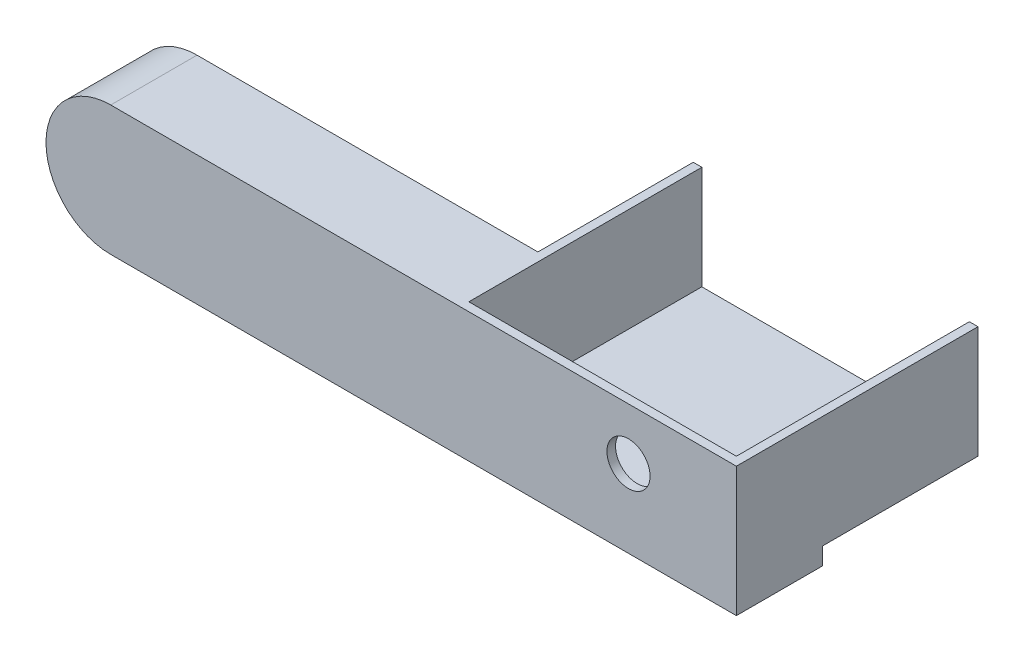
from build123d import *

# Parameters (mm, degrees)
SKETCH1_W                = 80
SKETCH1_H                = 15
BOSS_EXTRUDE1_DEPTH      = 10
FILLET1_R                = 7.5
BOSS_EXTRUDE2_DEPTH      = 2
BOSS_EXTRUDE2_DEPTH_BACK = 13
SKETCH2_R                = 3.5
SKETCH2_R_2              = 2.5
SKETCH4_W                = 12.275600057
SKETCH4_H                = 15
CUT_EXTRUDE1_DEPTH       = 39
SKETCH6_W                = 10
SKETCH6_H                = 14.887271561
CUT_EXTRUDE2_DEPTH       = 39
SKETCH8_W                = 33
SKETCH8_H                = 28
BOSS_EXTRUDE3_DEPTH      = 15
CUT_EXTRUDE3_DEPTH       = 12
SKETCH10_W               = 33
SKETCH10_H               = 18
CUT_EXTRUDE4_DEPTH       = 2
SKETCH11_W               = 11.438718319
SKETCH11_H               = 15
CUT_EXTRUDE5_DEPTH       = 84.360662185
SKETCH12_R               = 2.5
CUT_EXTRUDE6_DEPTH       = 86.755466298


with BuildPart() as part:
    # Sketch1 → Boss-Extrude1 (new body)
    with BuildSketch(Plane.XY):
        with Locations((40, 7.5)):
            Rectangle(SKETCH1_W, SKETCH1_H)
    extrude(amount=BOSS_EXTRUDE1_DEPTH)

    # Fillet1
    fillet1_edges = [part.edges().sort_by_distance(p)[0] for p in [
        (0, 0, 5),
        (0, 15, 5),
    ]]
    fillet(fillet1_edges, radius=FILLET1_R - 0.0001)  # a hair under: the kernel refuses the full size

    # Sketch2 → Boss-Extrude2 (add, two sides: drawn at the far end of the back side and taken through both)
    # profile 1 of 2: a face of its own
    with BuildSketch(Plane.XY.offset(10).offset(-BOSS_EXTRUDE2_DEPTH_BACK)):
        with Locations((7.5, 7.5)):
            Circle(SKETCH2_R)
        with Locations((7.5, 7.5)):
            Circle(SKETCH2_R_2, mode=Mode.SUBTRACT)
    # profile 2 of 2: a face of its own
    with BuildSketch(Plane.XY.offset(10).offset(-BOSS_EXTRUDE2_DEPTH_BACK)):
        with Locations((72.5, 7.5)):
            Circle(SKETCH2_R)
        with Locations((72.5, 7.5)):
            Circle(SKETCH2_R_2, mode=Mode.SUBTRACT)
    extrude(amount=BOSS_EXTRUDE2_DEPTH + BOSS_EXTRUDE2_DEPTH_BACK)

    # Sketch4 → Cut-Extrude1 (cut)
    with BuildSketch(Plane(origin=(80, 0, 0), x_dir=(0, 0, -1), z_dir=(1, 0, 0))):
        with Locations((6.137800029, 7.5)):
            Rectangle(SKETCH4_W, SKETCH4_H)
    extrude(amount=-CUT_EXTRUDE1_DEPTH, mode=Mode.SUBTRACT)

    # Sketch6 → Cut-Extrude2 (cut)
    with BuildSketch(Plane(origin=(0, 0, 0), x_dir=(0, 0, -1), z_dir=(1, 0, 0))):
        with Locations((-15, 7.443635781)):
            Rectangle(SKETCH6_W, SKETCH6_H)
    extrude(amount=CUT_EXTRUDE2_DEPTH, mode=Mode.SUBTRACT)

    # Sketch8 → Boss-Extrude3 (add)
    with BuildSketch(Plane(origin=(0, 15, 0), x_dir=(1, 0, 0), z_dir=(0, 1, 0))):
        with Locations((63.5, 4)):
            Rectangle(SKETCH8_W, SKETCH8_H)
    extrude(amount=-BOSS_EXTRUDE3_DEPTH)

    # Sketch9 → Cut-Extrude3 (cut)
    with BuildSketch(Plane(origin=(0, 15, 0), x_dir=(1, 0, 0), z_dir=(0, 1, 0))):
        Polygon((48, 17), (48, -9), (79, -9), (79, 17), (79, 18), (48, 18), align=None)
    extrude(amount=-CUT_EXTRUDE3_DEPTH, mode=Mode.SUBTRACT)

    # Sketch10 → Cut-Extrude4 (cut)
    with BuildSketch(Plane.XZ):
        with Locations((63.5, -9)):
            Rectangle(SKETCH10_W, SKETCH10_H)
    extrude(amount=-CUT_EXTRUDE4_DEPTH, mode=Mode.SUBTRACT)

    # Sketch11 → Cut-Extrude5 (cut, through all)
    with BuildSketch(Plane(origin=(80, 0, 0), x_dir=(0, 0, -1), z_dir=(1, 0, 0))):
        with Locations((-15.71935916, 7.5)):
            Rectangle(SKETCH11_W, SKETCH11_H)
    extrude(amount=-CUT_EXTRUDE5_DEPTH, mode=Mode.SUBTRACT)

    # Sketch12 → Cut-Extrude6 (cut, through all)
    with BuildSketch(Plane(origin=(0, 0, 9), x_dir=(-1, 0, 0), z_dir=(0, 0, -1))):
        with Locations((-67.5, 9)):
            Circle(SKETCH12_R)
    extrude(amount=-CUT_EXTRUDE6_DEPTH, mode=Mode.SUBTRACT)


solid = part.part
